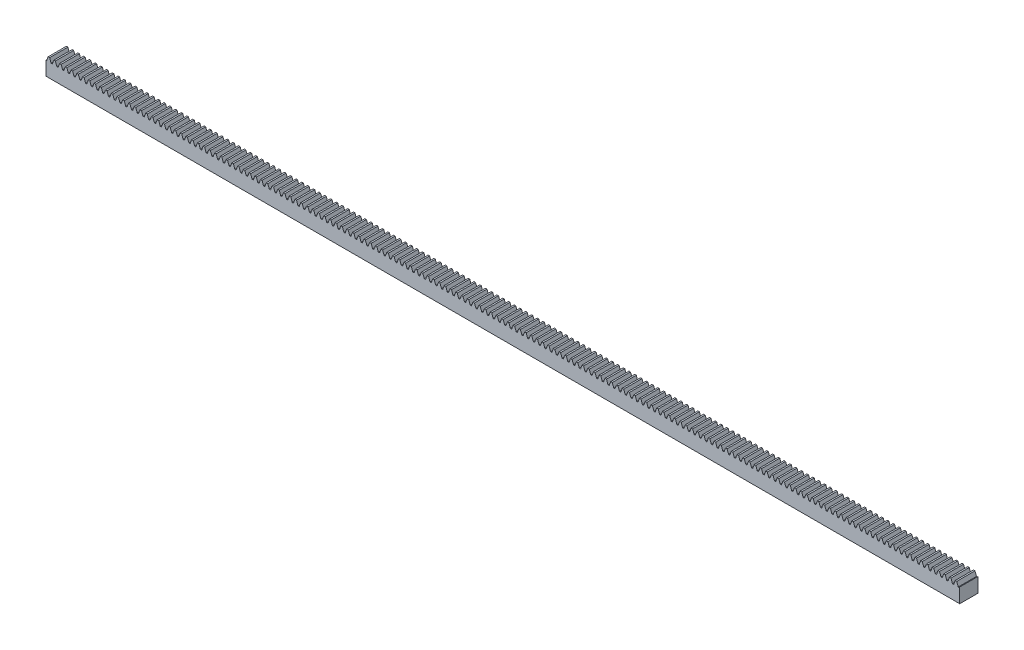
from build123d import *

# Parameters (mm, degrees)
RITNING_1_W          = 500
RITNING_1_H          = 9.8
KUGGST_NGS_MNE_DEPTH = 10
KUGGLUCKA_DEPTH      = 10
LPATTERN_COUNT       = 160
LPATTERN_PITCH       = 3.14159265


with BuildPart() as part:
    # Ritning 1 → Kuggstångsämne (new body)
    with BuildSketch(Plane.XY):
        with Locations((125.9, 0)):
            Rectangle(RITNING_1_W, RITNING_1_H)
    extrude(amount=KUGGST_NGS_MNE_DEPTH)

    # Ritning 2 → Kugglucka (cut)
    with BuildSketch(Plane.XY.offset(10)):
        with BuildLine():
            Line((-124.438289352, 2.65), (-123.761710648, 2.65))
            Line((-123.761710648, 2.65), (-122.942777621, 4.9))
            Line((-122.942777621, 4.9), (-124.1, 6.057222379))
            Line((-124.1, 6.057222379), (-125.257222379, 4.9))
            add(Edge.make_bspline(
                [(-125.257222379, 4.9), (-124.984244704, 4.15), (-124.711267028, 3.4), (-124.438289352, 2.65)],
                knots=[0, 0, 0, 0, 1, 1, 1, 1], degree=3))
        make_face()
    kugglucka = extrude(amount=-KUGGLUCKA_DEPTH, mode=Mode.SUBTRACT)

    # LPattern: Kugglucka ×160
    with Locations(*[(i * LPATTERN_PITCH, 0, 0) for i in range(1, LPATTERN_COUNT)]):
        add(kugglucka, mode=Mode.SUBTRACT)


solid = part.part
